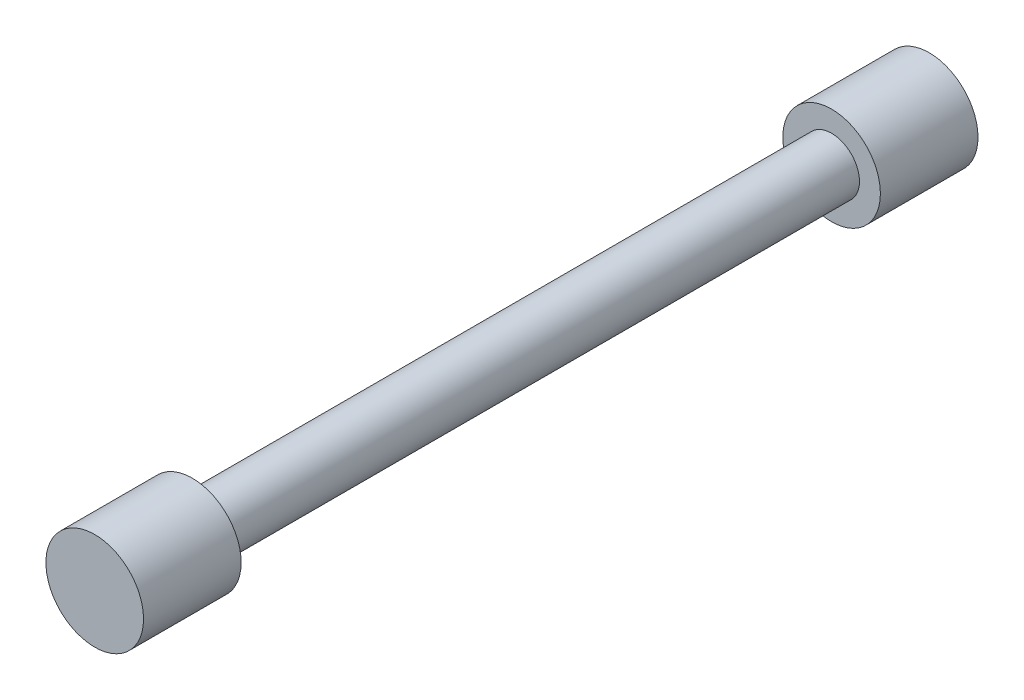
from build123d import *


with BuildPart() as part:
    # SK_Rod → Rod_Body (revolve)
    with BuildSketch(Plane(origin=(0, 0, 0), x_dir=(1, 0, 0), z_dir=(0, 1, 0))):
        Polygon((0, -7), (7, -7), (7, 7), (4, 7), (4, 98.683489723), (7, 98.683489723), (7, 112.683489723), (0, 112.683489723), align=None)
    revolve(axis=Axis((0, 0, 10), (0, 0, -1)))


solid = part.part
